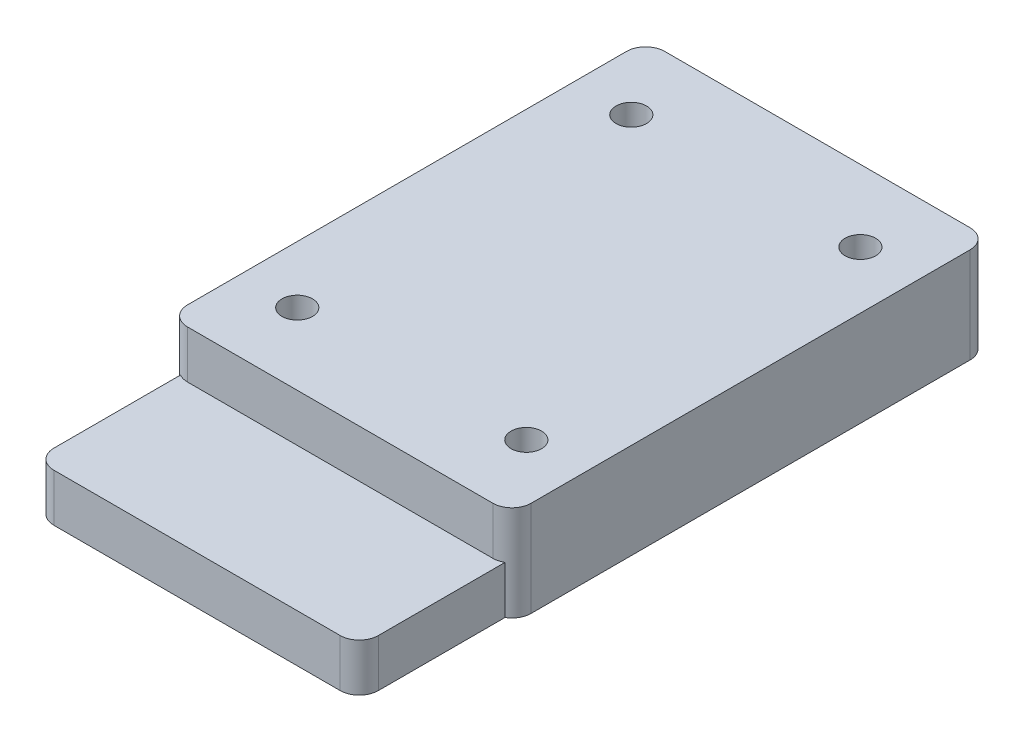
from build123d import *

# Parameters (mm, degrees)
SKETCH_1_W          = 36
SKETCH_1_H          = 50
SKETCH_1_W_2        = 34
SKETCH_1_H_2        = 15
EXTRUDE_1_DEPTH     = 10
SKETCH_2_R          = 1.6
CUT_EXTRUDE_1_DEPTH = 10
SKETCH_3_W          = 34
SKETCH_3_H          = 15
CUT_EXTRUDE_2_DEPTH = 5
FILLET_1_R          = 2


with BuildPart() as part:
    # 草图1 → 凸台-拉伸1 (new body)
    with BuildSketch(Plane(origin=(0, 0, 0), x_dir=(1, 0, 0), z_dir=(0, 1, 0))):
        Rectangle(SKETCH_1_W, SKETCH_1_H)
        with Locations((0, -32.5)):
            Rectangle(SKETCH_1_W_2, SKETCH_1_H_2)
    extrude(amount=EXTRUDE_1_DEPTH)

    # 草图2 → 切除-拉伸1 (cut)
    with BuildSketch(Plane(origin=(0, 10, 0), x_dir=(1, 0, 0), z_dir=(0, 1, 0))):
        with Locations(Location((12, 17.5, 0), (0, 0, 270))):
            Circle(SKETCH_2_R)
        with Locations(Location((-12, 17.5, 0), (0, 0, 270))):
            Circle(SKETCH_2_R)
        with Locations(Location((-12, -17.5, 0), (0, 0, 270))):
            Circle(SKETCH_2_R)
        with Locations(Location((12, -17.5, 0), (0, 0, 270))):
            Circle(SKETCH_2_R)
    extrude(amount=-CUT_EXTRUDE_1_DEPTH, mode=Mode.SUBTRACT)

    # 草图3 → 切除-拉伸2 (cut)
    with BuildSketch(Plane(origin=(0, 10, 0), x_dir=(1, 0, 0), z_dir=(0, 1, 0))):
        with Locations((0, -32.5)):
            Rectangle(SKETCH_3_W, SKETCH_3_H)
    extrude(amount=-CUT_EXTRUDE_2_DEPTH, mode=Mode.SUBTRACT)

    # 圆角1
    # the kernel refuses this fillet: 2 mm, written as the material it takes off along each edge
    with BuildSketch(Plane(origin=(18, -5, -25), x_dir=(0, 0, 1), z_dir=(0, 1, 0))) as fillet_1_piece_1:
        with BuildLine():
            CenterArc((FILLET_1_R, -FILLET_1_R), FILLET_1_R, 90, 90)
            Line((0, -FILLET_1_R), (0, 0))
            Line((0, 0), (FILLET_1_R, 0))
        make_face()
    extrude(amount=20, mode=Mode.SUBTRACT)
    with BuildSketch(Plane(origin=(17, -5, 40), x_dir=(-1, 0, 0), z_dir=(0, 1, 0)), Plane(origin=(-17, -5, 40), x_dir=(0, 0, -1), z_dir=(0, 1, 0))) as fillet_1_piece_2:
        with BuildLine():
            CenterArc((FILLET_1_R, -FILLET_1_R), FILLET_1_R, 90, 90)
            Line((0, -FILLET_1_R), (0, 0))
            Line((0, 0), (FILLET_1_R, 0))
        make_face()
    extrude(amount=15, mode=Mode.SUBTRACT)
    with BuildSketch(Plane(origin=(-18, -5, 25), x_dir=(0, 0, -1), z_dir=(0, 1, 0))) as fillet_1_piece_3_section:
        with BuildLine():
            CenterArc((FILLET_1_R, -FILLET_1_R), FILLET_1_R, 90, 90)
            Line((0, -FILLET_1_R), (0, 0))
            Line((0, 0), (FILLET_1_R, 0))
        make_face()
    fillet_1_piece_3 = extrude(amount=20, mode=Mode.PRIVATE)
    fillet_1_piece_3 = split(fillet_1_piece_3, bisect_by=Plane(origin=(-17, 2.5, 24.511950301), z_dir=(-1, 0, 0)), keep=Keep.TOP, mode=Mode.PRIVATE)
    add(fillet_1_piece_3, mode=Mode.SUBTRACT)
    with BuildSketch(Plane(origin=(-18, -5, 25), x_dir=(0, 0, -1), z_dir=(0, 1, 0))) as fillet_1_piece_4_section:
        with BuildLine():
            CenterArc((FILLET_1_R, -FILLET_1_R), FILLET_1_R, 90, 90)
            Line((0, -FILLET_1_R), (0, 0))
            Line((0, 0), (FILLET_1_R, 0))
        make_face()
    fillet_1_piece_4 = extrude(amount=20, mode=Mode.PRIVATE)
    fillet_1_piece_4 = split(fillet_1_piece_4, bisect_by=Plane(origin=(-16.753472775, 5, 24.920630815), z_dir=(0, 1, 0)), keep=Keep.TOP, mode=Mode.PRIVATE)
    add(fillet_1_piece_4, mode=Mode.SUBTRACT)
    with BuildSketch(Plane(origin=(18, -5, 25), x_dir=(0, 0, -1), z_dir=(0, 1, 0))) as fillet_1_piece_5_section:
        with BuildLine():
            CenterArc((FILLET_1_R, FILLET_1_R), FILLET_1_R, 180, 90)
            Line((0, FILLET_1_R), (0, 0))
            Line((0, 0), (FILLET_1_R, 0))
        make_face()
    fillet_1_piece_5 = extrude(amount=20, mode=Mode.PRIVATE)
    fillet_1_piece_5 = split(fillet_1_piece_5, bisect_by=Plane(origin=(17, 2.5, 24.511950301), z_dir=(1, 0, 0)), keep=Keep.TOP, mode=Mode.PRIVATE)
    add(fillet_1_piece_5, mode=Mode.SUBTRACT)
    with BuildSketch(Plane(origin=(18, -5, 25), x_dir=(0, 0, -1), z_dir=(0, 1, 0))) as fillet_1_piece_6_section:
        with BuildLine():
            CenterArc((FILLET_1_R, FILLET_1_R), FILLET_1_R, 180, 90)
            Line((0, FILLET_1_R), (0, 0))
            Line((0, 0), (FILLET_1_R, 0))
        make_face()
    fillet_1_piece_6 = extrude(amount=20, mode=Mode.PRIVATE)
    fillet_1_piece_6 = split(fillet_1_piece_6, bisect_by=Plane(origin=(16.753472775, 5, 24.920630815), z_dir=(0, 1, 0)), keep=Keep.TOP, mode=Mode.PRIVATE)
    add(fillet_1_piece_6, mode=Mode.SUBTRACT)
    with BuildSketch(Plane(origin=(-18, -5, -25), x_dir=(0, 0, 1), z_dir=(0, 1, 0))) as fillet_1_piece_7:
        with BuildLine():
            CenterArc((FILLET_1_R, FILLET_1_R), FILLET_1_R, 180, 90)
            Line((0, FILLET_1_R), (0, 0))
            Line((0, 0), (FILLET_1_R, 0))
        make_face()
    extrude(amount=20, mode=Mode.SUBTRACT)


solid = part.part
